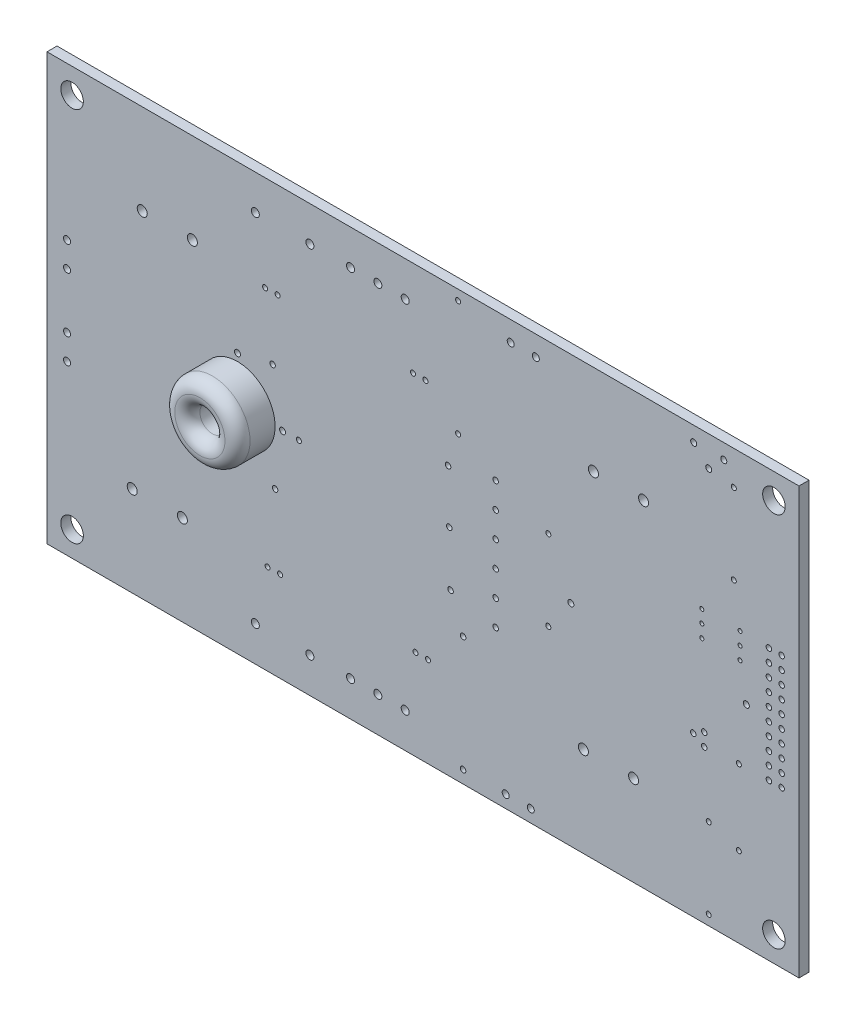
from build123d import *

# Parameters (mm, degrees)
SKETCH_1_W          = 150
SKETCH_1_H          = 85
SKETCH_1_R          = 2.25
EXTRUDE_1_DEPTH     = 2
SKETCH_2_R          = 0.55
SKETCH_2_R_2        = 0.5
SKETCH_2_R_3        = 0.8
CUT_EXTRUDE_1_DEPTH = 2
SKETCH_3_R          = 1
SKETCH_3_R_2        = 0.6
SKETCH_3_R_3        = 0.55
SKETCH_3_R_4        = 0.7
SKETCH_3_R_5        = 0.5
SKETCH_3_R_6        = 0.4
CUT_EXTRUDE_2_DEPTH = 10
SKETCH_4_R          = 0.6
SKETCH_4_R_2        = 0.5
SKETCH_4_R_3        = 0.55
CUT_EXTRUDE_3_DEPTH = 10
SKETCH_5_R          = 7.5
SKETCH_5_R_2        = 2.5
EXTRUDE_2_DEPTH     = 7.5
FILLET_1_R          = 2.5


with BuildPart() as part:
    # Эскиз1 → Вытянуть1 (new body)
    with BuildSketch(Plane.XY):
        Rectangle(SKETCH_1_W, SKETCH_1_H)
        with Locations((-70, -37.5)):
            Circle(SKETCH_1_R, mode=Mode.SUBTRACT)
        with Locations(Location((70, -37.5, 0), (0, 0, 180))):
            Circle(SKETCH_1_R, mode=Mode.SUBTRACT)
        with Locations((70, 37.5)):
            Circle(SKETCH_1_R, mode=Mode.SUBTRACT)
        with Locations(Location((-70, 37.5, 0), (0, 0, 180))):
            Circle(SKETCH_1_R, mode=Mode.SUBTRACT)
    extrude(amount=EXTRUDE_1_DEPTH)

    # Эскиз2 → Вырез-Вытянуть1 (cut)
    with BuildSketch(Plane.XY.offset(2)):
        with Locations((69, 11.5)):
            Circle(SKETCH_2_R)
        with Locations((71.54, 11.5)):
            Circle(SKETCH_2_R)
        with Locations((69, 8.96)):
            Circle(SKETCH_2_R)
        with Locations((71.54, 8.96)):
            Circle(SKETCH_2_R)
        with Locations((69, 6.42)):
            Circle(SKETCH_2_R)
        with Locations((71.54, 6.42)):
            Circle(SKETCH_2_R)
        with Locations((69, 3.88)):
            Circle(SKETCH_2_R)
        with Locations((71.54, 3.88)):
            Circle(SKETCH_2_R)
        with Locations((69, 1.34)):
            Circle(SKETCH_2_R)
        with Locations((71.54, 1.34)):
            Circle(SKETCH_2_R)
        with Locations((69, -1.2)):
            Circle(SKETCH_2_R)
        with Locations((71.54, -1.2)):
            Circle(SKETCH_2_R)
        with Locations((69, -3.74)):
            Circle(SKETCH_2_R)
        with Locations((71.54, -3.74)):
            Circle(SKETCH_2_R)
        with Locations((69, -6.28)):
            Circle(SKETCH_2_R)
        with Locations((71.54, -6.28)):
            Circle(SKETCH_2_R)
        with Locations((69, -8.82)):
            Circle(SKETCH_2_R)
        with Locations((71.54, -8.82)):
            Circle(SKETCH_2_R)
        with Locations((69, -11.36)):
            Circle(SKETCH_2_R)
        with Locations((71.54, -11.36)):
            Circle(SKETCH_2_R)
        with Locations((63, -26.5)):
            Circle(SKETCH_2_R_2)
        with Locations((63, -11.5)):
            Circle(SKETCH_2_R_2)
        with Locations((-14.45, 35.5)):
            Circle(SKETCH_2_R_3)
        with Locations((-9, 35.5)):
            Circle(SKETCH_2_R_3)
        with Locations((-3.55, 35.5)):
            Circle(SKETCH_2_R_3)
        with Locations((-33.45, 35.5)):
            Circle(SKETCH_2_R_3)
        with Locations((-24.75, 0.5)):
            Circle(SKETCH_2_R_2)
        with Locations((-22.55, 35.5)):
            Circle(SKETCH_2_R_3)
        with Locations((-33.45, -35.5)):
            Circle(SKETCH_2_R_3)
        with Locations((5.25, 0.5)):
            Circle(SKETCH_2_R)
        with Locations((-22.55, -35.5)):
            Circle(SKETCH_2_R_3)
        with Locations((-14.45, -35.5)):
            Circle(SKETCH_2_R_3)
        with Locations((-9, -35.5)):
            Circle(SKETCH_2_R_3)
        with Locations((-3.55, -35.5)):
            Circle(SKETCH_2_R_3)
        with Locations(Location((14.5, 13.2, 0), (0, 0, 180))):
            Circle(SKETCH_2_R)
        with Locations(Location((14.5, 8.12, 0), (0, 0, 180))):
            Circle(SKETCH_2_R)
        with Locations(Location((14.5, -2.04, 0), (0, 0, 180))):
            Circle(SKETCH_2_R)
        with Locations(Location((14.5, 3.04, 0), (0, 0, 180))):
            Circle(SKETCH_2_R)
        with Locations(Location((14.5, -7.12, 0), (0, 0, 180))):
            Circle(SKETCH_2_R)
        with Locations((14.5, -12.2)):
            Circle(SKETCH_2_R)
    extrude(amount=-CUT_EXTRUDE_1_DEPTH, mode=Mode.SUBTRACT)

    # Эскиз3 → Вырез-Вытянуть2 (cut)
    with BuildSketch(Plane.XY.offset(2)):
        with Locations((-56, 24.5)):
            Circle(SKETCH_3_R)
        with Locations((-46, 24.5)):
            Circle(SKETCH_3_R)
        with Locations((-58, -24.5)):
            Circle(SKETCH_3_R)
        with Locations((-48, -24.5)):
            Circle(SKETCH_3_R)
        with Locations((54, 39.5)):
            Circle(SKETCH_3_R_2)
        with Locations((60, 39.5)):
            Circle(SKETCH_3_R_2)
        with Locations((56.095, -9.48)):
            Circle(SKETCH_3_R_3)
        with Locations((56.095, -12.02)):
            Circle(SKETCH_3_R_3)
        with Locations((53.905, -10.75)):
            Circle(SKETCH_3_R_3)
        with Locations((16.5, -40)):
            Circle(SKETCH_3_R_4)
        with Locations((21.5, -40)):
            Circle(SKETCH_3_R_4)
        with Locations((-71, 7)):
            Circle(SKETCH_3_R_4)
        with Locations((-71, 12)):
            Circle(SKETCH_3_R_4)
        with Locations((-71, -9)):
            Circle(SKETCH_3_R_4)
        with Locations((-71, -4)):
            Circle(SKETCH_3_R_4)
        with Locations((25, -6.75)):
            Circle(SKETCH_3_R_5)
        with Locations((25, 9.25)):
            Circle(SKETCH_3_R_5)
        with Locations((57, -40.5)):
            Circle(SKETCH_3_R_5)
        with Locations((57, -24.5)):
            Circle(SKETCH_3_R_5)
        with Locations((34, 24.5)):
            Circle(SKETCH_3_R)
        with Locations((44, 24.5)):
            Circle(SKETCH_3_R)
        with Locations((32, -24.5)):
            Circle(SKETCH_3_R)
        with Locations((42, -24.5)):
            Circle(SKETCH_3_R)
        with Locations((57, 36.5)):
            Circle(SKETCH_3_R_2)
        with Locations((17.5, 38.5)):
            Circle(SKETCH_3_R_4)
        with Locations((62, 19.75)):
            Circle(SKETCH_3_R_5)
        with Locations((62, 35.75)):
            Circle(SKETCH_3_R_5)
        with Locations((63.24, 11.58)):
            Circle(SKETCH_3_R_6)
        with Locations((63.24, 6.5)):
            Circle(SKETCH_3_R_6)
        with Locations((55.62, 9.04)):
            Circle(SKETCH_3_R_6)
        with Locations((63.24, 9.04)):
            Circle(SKETCH_3_R_6)
        with Locations((55.62, 6.5)):
            Circle(SKETCH_3_R_6)
        with Locations((55.62, 11.58)):
            Circle(SKETCH_3_R_6)
        with Locations((22.5, 38.5)):
            Circle(SKETCH_3_R_4)
        with Locations((64.5, -0.5)):
            Circle(SKETCH_3_R_2)
        with Locations((29.5, -0.5)):
            Circle(SKETCH_3_R_2)
    extrude(amount=-CUT_EXTRUDE_2_DEPTH, mode=Mode.SUBTRACT)

    # Эскиз4 → Вырез-Вытянуть3 (cut)
    with BuildSketch(Plane.XY.offset(2)):
        with Locations((-37, -8.5)):
            Circle(SKETCH_4_R)
        with Locations((-28, 0.5)):
            Circle(SKETCH_4_R)
        with Locations((-31.5, 23.5)):
            Circle(SKETCH_4_R_2)
        with Locations((-37, 9.45)):
            Circle(SKETCH_4_R)
        with Locations((0.5, 23.5)):
            Circle(SKETCH_4_R_2)
        with Locations((-29, 23.5)):
            Circle(SKETCH_4_R_2)
        with Locations((-11, 51)):
            Circle(SKETCH_4_R_2)
        with Locations((-11, 74)):
            Circle(SKETCH_4_R_2)
        with Locations((-2, 23.5)):
            Circle(SKETCH_4_R_2)
        with Locations((8, -40)):
            Circle(SKETCH_4_R_3)
        with Locations((8, -17)):
            Circle(SKETCH_4_R_3)
        with Locations((-68, 56)):
            Circle(SKETCH_4_R_2)
        with Locations((-68, 51)):
            Circle(SKETCH_4_R_2)
        with Locations((7, 17.5)):
            Circle(SKETCH_4_R_2)
        with Locations((7, 40.5)):
            Circle(SKETCH_4_R_2)
        with Locations((-52, 56)):
            Circle(SKETCH_4_R_2)
        with Locations((-52, 51)):
            Circle(SKETCH_4_R_2)
        with Locations((-30, 11)):
            Circle(SKETCH_4_R_3)
        with Locations((5, 11)):
            Circle(SKETCH_4_R_3)
        with Locations((-35.5, 0.5)):
            Circle(SKETCH_4_R)
        with Locations((-29.5, -10.25)):
            Circle(SKETCH_4_R_3)
        with Locations((5.5, -10.25)):
            Circle(SKETCH_4_R_3)
        with Locations((-31, -24.5)):
            Circle(SKETCH_4_R_2)
        with Locations((1, -24.5)):
            Circle(SKETCH_4_R_2)
        with Locations((-28.5, -24.5)):
            Circle(SKETCH_4_R_2)
        with Locations((-1.5, -24.5)):
            Circle(SKETCH_4_R_2)
    extrude(amount=-CUT_EXTRUDE_3_DEPTH, mode=Mode.SUBTRACT)

    # Эскиз5 → Вытянуть2 (add)
    with BuildSketch(Plane.XY.offset(2)):
        with Locations(Location((-37, 0.5, 0), (0, 0, 180))):
            Circle(SKETCH_5_R)
        with Locations((-37, 0.5)):
            Circle(SKETCH_5_R_2, mode=Mode.SUBTRACT)
    extrude(amount=EXTRUDE_2_DEPTH)

    # Скругление1
    fillet_1_edges = [part.edges().sort_by_distance(p)[0] for p in [
        (-29.5, 0.5, 9.5),
        (-39.5, 0.5, 9.5),
    ]]
    fillet(fillet_1_edges, radius=FILLET_1_R - 0.0001)  # a hair under: the kernel refuses the full size


solid = part.part
